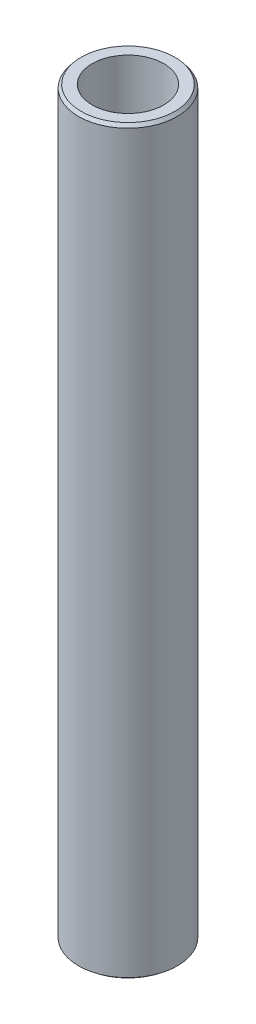
from build123d import *
from OCP.BRepFilletAPI import BRepFilletAPI_MakeChamfer

# Parameters (mm, degrees)
SKETCH1_R           = 40
BOSS_EXTRUDE1_DEPTH = 600
SKETCH2_R           = 28.997838178
CUT_EXTRUDE1_DEPTH  = 603.660766933
CHAMFER1_SIZE       = 2.551090159
CHAMFER1_SIZE2      = 2.030757489


with BuildPart() as part:
    # Sketch1 → Boss-Extrude1 (new body)
    with BuildSketch(Plane(origin=(0, 0, 0), x_dir=(1, 0, 0), z_dir=(0, 1, 0))):
        Circle(SKETCH1_R)
    extrude(amount=BOSS_EXTRUDE1_DEPTH)

    # Sketch2 → Cut-Extrude1 (cut, through all)
    with BuildSketch(Plane(origin=(0, 0, 0), x_dir=(1, 0, 0), z_dir=(0, 1, 0))):
        Circle(SKETCH2_R)
    extrude(amount=CUT_EXTRUDE1_DEPTH, mode=Mode.SUBTRACT)

    # Chamfer1: one chamfer whose edges measure the first distance from different faces: ONE call of the kernel's chamfer builder (chamfer() names one face for all edges)
    chamfer1_edges_1 = [part.edges().sort_by_distance(p)[0] for p in [
        (-40, 600, 0),
    ]]
    chamfer1_side_1 = [part.faces().sort_by_distance(p)[0] for p in [
        (-40, 300, 0),
    ]]
    chamfer1_edges_2 = [part.edges().sort_by_distance(p)[0] for p in [
        (-40, 0, 0),
    ]]
    chamfer1_side_2 = [part.faces().sort_by_distance(p)[0] for p in [
        (-38.86862915, 0, 0),
    ]]
    chamfer1 = BRepFilletAPI_MakeChamfer(part.part.solid().wrapped)
    for e in chamfer1_edges_1:
        chamfer1.Add(CHAMFER1_SIZE, CHAMFER1_SIZE2, e.wrapped, chamfer1_side_1[0].wrapped)  # the first distance lies on this face
    for e in chamfer1_edges_2:
        chamfer1.Add(CHAMFER1_SIZE, CHAMFER1_SIZE2, e.wrapped, chamfer1_side_2[0].wrapped)  # the first distance lies on this face
    add(Compound.cast(chamfer1.Shape()), mode=Mode.REPLACE)


solid = part.part
